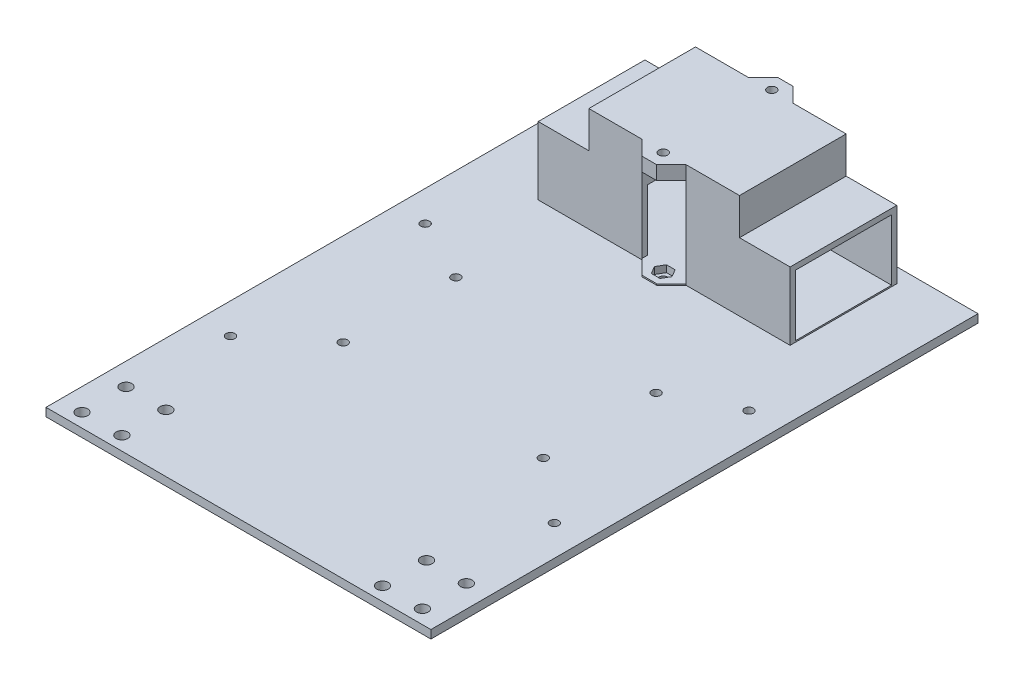
from build123d import *
from build123d.topology import SkipClean

# Parameters (mm, degrees)
SKETCH1_W            = 140
SKETCH1_H            = 198
BOSS_EXTRUDE1_DEPTH  = 3
SKETCH2_R            = 2.1
CUT_EXTRUDE1_DEPTH   = 3
SKETCH3_R            = 1.6
CUT_EXTRUDE2_DEPTH   = 3
SKETCH4_W            = 140
SKETCH4_H            = 3
BOSS_EXTRUDE2_DEPTH  = 1
SKETCH5_R            = 1.6
CUT_EXTRUDE3_DEPTH   = 16
BOSS_EXTRUDE3_DEPTH  = 21
SKETCH7_W            = 34.8
SKETCH7_H            = 21
CUT_EXTRUDE4_DEPTH   = 21
SKETCH9_W            = 91.613735238
SKETCH9_H            = 38.8
BOSS_EXTRUDE4_DEPTH  = 2
SKETCH12_W           = 20
SKETCH12_H           = 23
CUT_EXTRUDE8_DEPTH   = 4
SKETCH13_W           = 20
SKETCH13_H           = 2
BOSS_EXTRUDE5_DEPTH  = 4
SKETCH15_W           = 16
SKETCH15_H           = 2
BOSS_EXTRUDE6_DEPTH  = 5.35
SKETCH16_W           = 16
SKETCH16_H           = 2
BOSS_EXTRUDE7_DEPTH  = 5.35
SKETCH17_R           = 1.6
CUT_EXTRUDE9_DEPTH   = 6
CHAMFER1_SIZE        = 5.35
SKETCH18_R           = 1.6
CUT_EXTRUDE10_DEPTH  = 6
BOSS_EXTRUDE8_START  = 15
SKETCH19_R           = 1.6
BOSS_EXTRUDE8_DEPTH  = 15
CUT_EXTRUDE11_DEPTH  = 12
SKETCH21_W           = 18.406867619
SKETCH21_H           = 38.8
CUT_EXTRUDE12_DEPTH  = 15
SKETCH22_W           = 37.806867619
SKETCH22_H           = 34.8
CUT_EXTRUDE13_DEPTH  = 1
SKETCH23_W           = 18.406867619
SKETCH23_H           = 38.8
BOSS_EXTRUDE9_DEPTH  = 1
SKETCH24_W           = 37.806867619
SKETCH24_H           = 22
SKETCH24_W_2         = 35.806867619
CUT_EXTRUDE14_DEPTH  = 0.1
SKETCH25_W           = 37.806867619
SKETCH25_H           = 22
SKETCH25_W_2         = 35.806867619
CUT_EXTRUDE15_DEPTH  = 0.1
CUT_EXTRUDE16_DEPTH  = 2.6
CUT_EXTRUDE17_DEPTH  = 2
SKETCH28_W           = 37.806867619
SKETCH28_H           = 35
CUT_EXTRUDE18_DEPTH  = 0.5
SKETCH29_W           = 18.406867619
SKETCH29_H           = 38.8
CUT_EXTRUDE19_DEPTH  = 0.5
SKETCH30_W           = 37.806867619
SKETCH30_H           = 35
BOSS_EXTRUDE10_DEPTH = 0.5
SKETCH31_R           = 1.6
BOSS_EXTRUDE11_DEPTH = 0.5
CUT_EXTRUDE20_DEPTH  = 2.5
SKETCH33_W           = 37.806867619
SKETCH33_H           = 35
CUT_EXTRUDE21_DEPTH  = 0.2
BOSS_EXTRUDE12_DEPTH = 1.3
SKETCH35_W           = 18.406867619
SKETCH35_H           = 38.8
BOSS_EXTRUDE13_DEPTH = 1.2


with BuildPart() as part:
    # Sketch1 → Boss-Extrude1 (new body)
    with BuildSketch(Plane(origin=(0, 0, 0), x_dir=(1, 0, 0), z_dir=(0, 1, 0))):
        Rectangle(SKETCH1_W, SKETCH1_H)
    extrude(amount=BOSS_EXTRUDE1_DEPTH)

    # Sketch2 → Cut-Extrude1 (cut)
    with BuildSketch(Plane(origin=(0, 3, 0), x_dir=(1, 0, 0), z_dir=(0, 1, 0))):
        with Locations(Location((-47.4, -94, 0), (0, 0, 270))):
            Circle(SKETCH2_R)
        with Locations(Location((47.4, -94, 0), (0, 0, 270))):
            Circle(SKETCH2_R)
        with Locations(Location((-61.9, -94, 0), (0, 0, 270))):
            Circle(SKETCH2_R)
        with Locations(Location((61.9, -94, 0), (0, 0, 270))):
            Circle(SKETCH2_R)
        with Locations(Location((-47.4, -78, 0), (0, 0, 270))):
            Circle(SKETCH2_R)
        with Locations(Location((-61.9, -78, 0), (0, 0, 270))):
            Circle(SKETCH2_R)
        with Locations(Location((61.9, -78, 0), (0, 0, 270))):
            Circle(SKETCH2_R)
        with Locations(Location((47.4, -78, 0), (0, 0, 270))):
            Circle(SKETCH2_R)
    extrude(amount=-CUT_EXTRUDE1_DEPTH, mode=Mode.SUBTRACT)

    # Sketch3 → Cut-Extrude2 (cut)
    with BuildSketch(Plane(origin=(0, 3, 0), x_dir=(1, 0, 0), z_dir=(0, 1, 0))):
        with Locations(Location((-58.9, 27.8, 0), (0, 0, 270))):
            Circle(SKETCH3_R)
        with Locations(Location((-58.9, -43, 0), (0, 0, 270))):
            Circle(SKETCH3_R)
        with Locations(Location((58.9, -43, 0), (0, 0, 270))):
            Circle(SKETCH3_R)
        with Locations(Location((58.9, 27.8, 0), (0, 0, 270))):
            Circle(SKETCH3_R)
    extrude(amount=-CUT_EXTRUDE2_DEPTH, mode=Mode.SUBTRACT)

    # Sketch4 → Boss-Extrude2 (add)
    with BuildSketch(Plane(origin=(0, 0, -99), x_dir=(-1, 0, 0), z_dir=(0, 0, -1))):
        with Locations((0, 1.5)):
            Rectangle(SKETCH4_W, SKETCH4_H)
    extrude(amount=BOSS_EXTRUDE2_DEPTH)

    # Sketch5 → Cut-Extrude3 (cut)
    with BuildSketch(Plane(origin=(0, 3, 0), x_dir=(1, 0, 0), z_dir=(0, 1, 0))):
        with Locations(Location((0, 95, 0), (0, 0, 270))):
            Circle(SKETCH5_R)
        with Locations(Location((0, 55.5, 0), (0, 0, 270))):
            Circle(SKETCH5_R)
    extrude(amount=-CUT_EXTRUDE3_DEPTH, mode=Mode.SUBTRACT)

    # Sketch6 → Boss-Extrude3 (add)
    with BuildSketch(Plane(origin=(0, 3, 0), x_dir=(1, 0, 0), z_dir=(0, 1, 0))):
        Polygon((-45.806867619, 94.65), (-8, 94.65), (-8, 92.65), (-43.806867619, 92.65), (-43.806867619, 57.85), (-8, 57.85), (-8, 55.85), (-45.806867619, 55.85), align=None)
        Polygon((43.806867619, 92.65), (43.806867619, 57.85), (8, 57.85), (8, 55.85), (45.806867619, 55.85), (45.806867619, 94.65), (8, 94.65), (8, 92.65), align=None)
    extrude(amount=BOSS_EXTRUDE3_DEPTH)

    # Sketch7 → Cut-Extrude4 (cut)
    with BuildSketch(Plane.ZY.offset(-43.806867619)):
        with Locations((-75.25, 13.5)):
            Rectangle(SKETCH7_W, SKETCH7_H)
    extrude(amount=-CUT_EXTRUDE4_DEPTH, mode=Mode.SUBTRACT)

    # Sketch9 → Boss-Extrude4 (add)
    with BuildSketch(Plane(origin=(0, 24, 0), x_dir=(1, 0, 0), z_dir=(0, 1, 0))):
        with Locations((0, 75.25)):
            Rectangle(SKETCH9_W, SKETCH9_H)
    extrude(amount=BOSS_EXTRUDE4_DEPTH)

    # Sketch12 → Cut-Extrude8 (cut)
    with BuildSketch(Plane.ZY.offset(45.806867619)):
        with Locations((-75.25, 14.5)):
            Rectangle(SKETCH12_W, SKETCH12_H)
    extrude(amount=-CUT_EXTRUDE8_DEPTH, mode=Mode.SUBTRACT)

    # Sketch13 → Boss-Extrude5 (add)
    with BuildSketch(Plane.ZY.offset(41.806867619)):
        with Locations((-75.25, 25)):
            Rectangle(SKETCH13_W, SKETCH13_H)
    extrude(amount=BOSS_EXTRUDE5_DEPTH)

    # Sketch15 → Boss-Extrude6 (add)
    with BuildSketch(Plane.XY.offset(-55.85)):
        with Locations((0, 25)):
            Rectangle(SKETCH15_W, SKETCH15_H)
    extrude(amount=BOSS_EXTRUDE6_DEPTH)

    # Sketch16 → Boss-Extrude7 (add)
    with BuildSketch(Plane(origin=(0, 0, -94.65), x_dir=(-1, 0, 0), z_dir=(0, 0, -1))):
        with Locations((0, 25)):
            Rectangle(SKETCH16_W, SKETCH16_H)
    extrude(amount=BOSS_EXTRUDE7_DEPTH)

    # Sketch17 → Cut-Extrude9 (cut)
    with BuildSketch(Plane(origin=(0, 26, 0), x_dir=(1, 0, 0), z_dir=(0, 1, 0))):
        with Locations(Location((0, 55.5, 0), (0, 0, 270))):
            Circle(SKETCH17_R)
        with Locations(Location((0, 95, 0), (0, 0, 270))):
            Circle(SKETCH17_R)
    extrude(amount=-CUT_EXTRUDE9_DEPTH, mode=Mode.SUBTRACT)

    # Chamfer1
    chamfer1_edges = [part.edges().sort_by_distance(p)[0] for p in [
        (-8, 25, -50.5),
        (8, 25, -50.5),
        (8, 25, -100),
        (-8, 25, -100),
    ]]
    chamfer(chamfer1_edges, length=CHAMFER1_SIZE - 0.0001)  # a hair under: the kernel refuses the full size

    # Sketch18 → Cut-Extrude10 (cut)
    with BuildSketch(Plane(origin=(0, 3, 0), x_dir=(1, 0, 0), z_dir=(0, 1, 0))):
        with Locations(Location((36.4, -24.5, 0), (0, 0, 270))):
            Circle(SKETCH18_R)
        with Locations(Location((36.4, 16.5, 0), (0, 0, 270))):
            Circle(SKETCH18_R)
        with Locations(Location((-36.4, 16.5, 0), (0, 0, 270))):
            Circle(SKETCH18_R)
        with Locations(Location((-36.4, -24.5, 0), (0, 0, 270))):
            Circle(SKETCH18_R)
    extrude(amount=-CUT_EXTRUDE10_DEPTH, mode=Mode.SUBTRACT)

    # Sketch19 → Boss-Extrude8 (add)
    with SkipClean():  # the faces are left unmerged after this step: merging them gives an invalid solid
        with BuildSketch(Plane(origin=(0, 26, 0), x_dir=(1, 0, 0), z_dir=(0, 1, 0)).offset(BOSS_EXTRUDE8_START)):
            Polygon((-45.806867619, 55.85), (-8, 55.85), (-2.65, 50.5), (2.65, 50.5), (8, 55.85), (45.806867619, 55.85), (45.806867619, 94.65), (8, 94.65), (2.65, 100), (-2.65, 100), (-8, 94.65), (-45.806867619, 94.65), align=None)
            with Locations(Location((0, 95, 0), (0, 0, 270))):
                Circle(SKETCH19_R, mode=Mode.SUBTRACT)
            with Locations(Location((0, 55.5, 0), (0, 0, 270))):
                Circle(SKETCH19_R, mode=Mode.SUBTRACT)
        extrude(amount=-BOSS_EXTRUDE8_DEPTH)

    # Sketch20 → Cut-Extrude11 (cut)
    with SkipClean():  # the faces are left unmerged after this step: merging them gives an invalid solid
        with BuildSketch(Plane.XZ.offset(-24)):
            Polygon((-8, -55.85), (-8, -94.65), (-2.65, -100), (2.65, -100), (8, -94.65), (8, -55.85), (2.65, -50.5), (-2.65, -50.5), align=None)
        extrude(amount=-CUT_EXTRUDE11_DEPTH, mode=Mode.SUBTRACT)


with BuildPart() as cut_extrude11_kept_piece:
    # of the separate pieces the step leaves, the one the design keeps (cut_extrude11_pieces_kept)
    add(part.part.solids().sort_by_distance((-45.806867619, 26, -94.65))[0])

    # Sketch21 → Cut-Extrude12 (cut)
    with BuildSketch(Plane(origin=(0, 41, 0), x_dir=(1, 0, 0), z_dir=(0, 1, 0))):
        with Locations((-36.60343381, 75.25)):
            Rectangle(SKETCH21_W, SKETCH21_H)
        with Locations((36.60343381, 75.25)):
            Rectangle(SKETCH21_W, SKETCH21_H)
    extrude(amount=-CUT_EXTRUDE12_DEPTH, mode=Mode.SUBTRACT)

    # Sketch22 → Cut-Extrude13 (cut)
    with BuildSketch(Plane.XZ.offset(-24)):
        with Locations((26.90343381, -75.25)):
            Rectangle(SKETCH22_W, SKETCH22_H)
        Polygon((-43.806867619, -92.65), (-8, -92.65), (-8, -57.85), (-43.806867619, -57.85), (-43.806867619, -65.25), (-45.806867619, -65.25), (-45.806867619, -85.25), (-43.806867619, -85.25), align=None)
    extrude(amount=-CUT_EXTRUDE13_DEPTH, mode=Mode.SUBTRACT)

    # Sketch23 → Boss-Extrude9 (add)
    with BuildSketch(Plane(origin=(0, 26, 0), x_dir=(1, 0, 0), z_dir=(0, 1, 0))):
        with Locations((36.60343381, 75.25)):
            Rectangle(SKETCH23_W, SKETCH23_H)
        with Locations((-36.60343381, 75.25)):
            Rectangle(SKETCH23_W, SKETCH23_H)
    extrude(amount=BOSS_EXTRUDE9_DEPTH)

    # Sketch24 → Cut-Extrude14 (cut)
    with BuildSketch(Plane(origin=(0, 0, -57.85), x_dir=(-1, 0, 0), z_dir=(0, 0, -1))):
        with Locations((-26.90343381, 14)):
            Rectangle(SKETCH24_W, SKETCH24_H)
        with Locations((25.90343381, 14)):
            Rectangle(SKETCH24_W_2, SKETCH24_H)
    extrude(amount=-CUT_EXTRUDE14_DEPTH, mode=Mode.SUBTRACT)

    # Sketch25 → Cut-Extrude15 (cut)
    with BuildSketch(Plane.XY.offset(-92.65)):
        with Locations((26.90343381, 14)):
            Rectangle(SKETCH25_W, SKETCH25_H)
        with Locations((-25.90343381, 14)):
            Rectangle(SKETCH25_W_2, SKETCH25_H)
    extrude(amount=-CUT_EXTRUDE15_DEPTH, mode=Mode.SUBTRACT)

    # Sketch26 → Cut-Extrude16 (cut)
    with BuildSketch(Plane.XZ.offset(-36)):
        Polygon((3.175426481, -55.5), (1.58771324, -52.75), (-1.58771324, -52.75), (-3.175426481, -55.5), (-1.58771324, -58.25), (1.58771324, -58.25), align=None)
        Polygon((3.175426481, -95), (1.58771324, -92.25), (-1.58771324, -92.25), (-3.175426481, -95), (-1.58771324, -97.75), (1.58771324, -97.75), align=None)
    extrude(amount=-CUT_EXTRUDE16_DEPTH, mode=Mode.SUBTRACT)

    # Sketch27 → Cut-Extrude17 (cut)
    with BuildSketch(Plane(origin=(0, 3, 0), x_dir=(1, 0, 0), z_dir=(0, 1, 0))):
        Polygon((3.175426481, 55.5), (1.58771324, 58.25), (-1.58771324, 58.25), (-3.175426481, 55.5), (-1.58771324, 52.75), (1.58771324, 52.75), align=None)
    extrude(amount=-CUT_EXTRUDE17_DEPTH, mode=Mode.SUBTRACT)

    # Sketch28 → Cut-Extrude18 (cut)
    with BuildSketch(Plane.XZ.offset(-25)):
        Polygon((-43.806867619, -85.25), (-43.806867619, -92.75), (-8, -92.75), (-8, -57.75), (-43.806867619, -57.75), (-43.806867619, -65.25), (-45.806867619, -65.25), (-45.806867619, -85.25), align=None)
        with Locations((26.90343381, -75.25)):
            Rectangle(SKETCH28_W, SKETCH28_H)
    extrude(amount=-CUT_EXTRUDE18_DEPTH, mode=Mode.SUBTRACT)

    # Sketch29 → Cut-Extrude19 (cut)
    with BuildSketch(Plane(origin=(0, 27, 0), x_dir=(1, 0, 0), z_dir=(0, 1, 0))):
        with Locations((36.60343381, 75.25)):
            Rectangle(SKETCH29_W, SKETCH29_H)
        with Locations((-36.60343381, 75.25)):
            Rectangle(SKETCH29_W, SKETCH29_H)
    extrude(amount=-CUT_EXTRUDE19_DEPTH, mode=Mode.SUBTRACT)

    # Sketch30 → Boss-Extrude10 (add)
    with BuildSketch(Plane(origin=(0, 3, 0), x_dir=(1, 0, 0), z_dir=(0, 1, 0))):
        with Locations((26.90343381, 75.25)):
            Rectangle(SKETCH30_W, SKETCH30_H)
        Polygon((-43.806867619, 85.25), (-45.806867619, 85.25), (-45.806867619, 65.25), (-43.806867619, 65.25), (-43.806867619, 57.75), (-8, 57.75), (-8, 92.75), (-43.806867619, 92.75), align=None)
    extrude(amount=BOSS_EXTRUDE10_DEPTH)

    # Sketch31 → Boss-Extrude11 (add)
    with BuildSketch(Plane(origin=(0, 3, 0), x_dir=(1, 0, 0), z_dir=(0, 1, 0))):
        Polygon((-27.4, 94.65), (-27.4, 55.85), (-8, 55.85), (-2.65, 50.5), (2.65, 50.5), (8, 55.85), (27.4, 55.85), (27.4, 94.65), (8, 94.65), (2.65, 100), (-2.65, 100), (-8, 94.65), align=None)
        with Locations(Location((0, 95, 0), (0, 0, 270))):
            Circle(SKETCH31_R, mode=Mode.SUBTRACT)
        Polygon((1.58771324, 52.75), (3.175426481, 55.5), (1.58771324, 58.25), (-1.58771324, 58.25), (-3.175426481, 55.5), (-1.58771324, 52.75), align=None, mode=Mode.SUBTRACT)
    extrude(amount=BOSS_EXTRUDE11_DEPTH)

    # Sketch32 → Cut-Extrude20 (cut)
    with BuildSketch(Plane(origin=(0, 3.5, 0), x_dir=(1, 0, 0), z_dir=(0, 1, 0))):
        Polygon((3.175426481, 95), (1.58771324, 97.75), (-1.58771324, 97.75), (-3.175426481, 95), (-1.58771324, 92.25), (1.58771324, 92.25), align=None)
    extrude(amount=-CUT_EXTRUDE20_DEPTH, mode=Mode.SUBTRACT)

    # Sketch33 → Cut-Extrude21 (cut)
    with BuildSketch(Plane.XZ.offset(-25.5)):
        with Locations((26.90343381, -75.25)):
            Rectangle(SKETCH33_W, SKETCH33_H)
        Polygon((-45.806867619, -85.25), (-43.806867619, -85.25), (-43.806867619, -92.75), (-8, -92.75), (-8, -57.75), (-43.806867619, -57.75), (-43.806867619, -65.25), (-45.806867619, -65.25), align=None)
    extrude(amount=-CUT_EXTRUDE21_DEPTH, mode=Mode.SUBTRACT)

    # Sketch34 → Boss-Extrude12 (add)
    with BuildSketch(Plane(origin=(0, 3.5, 0), x_dir=(1, 0, 0), z_dir=(0, 1, 0))):
        Polygon((2.65, 100), (8, 100), (8, 94.65), align=None)
        Polygon((-8, 94.65), (-8, 100), (-2.65, 100), align=None)
    extrude(amount=-BOSS_EXTRUDE12_DEPTH)

    # Sketch35 → Boss-Extrude13 (add)
    with BuildSketch(Plane(origin=(0, 26.5, 0), x_dir=(1, 0, 0), z_dir=(0, 1, 0))):
        with Locations((36.60343381, 75.25)):
            Rectangle(SKETCH35_W, SKETCH35_H)
        with Locations((-36.60343381, 75.25)):
            Rectangle(SKETCH35_W, SKETCH35_H)
    extrude(amount=BOSS_EXTRUDE13_DEPTH)


solid = cut_extrude11_kept_piece.part
